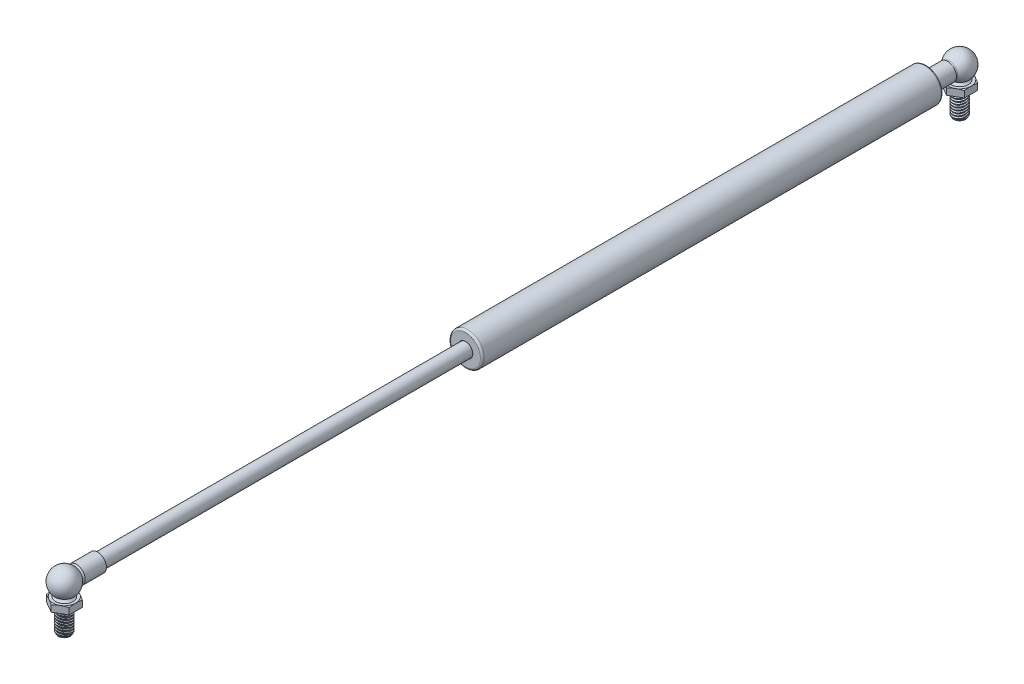
from build123d import *
from build123d.topology import SkipClean

# Parameters (mm, degrees)
FILLET2_R           = 1.0876
EXTRUDE1_DEPTH      = 4
SKETCH6_OUTSIDE_W   = 1534.002
SKETCH6_OUTSIDE_H   = 1804.448
SKETCH6_OUTSIDE_R   = 6.5
CUT_EXTRUDE2_DEPTH  = 264.747499835
CUT_EXTRUDE2_DRAFT  = -70
LPATTERN1_COUNT     = 10
LPATTERN1_PITCH     = 1.411111111
LPATTERN1_COL_COUNT = 2
LPATTERN1_COL_PITCH = 1.411111111
SKETCH9_W           = 230.058
SKETCH9_H           = 3.937
SPLIT1_START        = 6.466
SPLIT1_OUTLINE_R    = 3.937
SPLIT1_DEPTH        = 20
SPLIT1_2_OUTLINE_R  = 3.937
SPLIT1_2_DEPTH      = 20


# Read off the part's stored shape, not the designer's step: Split1
with BuildPart() as part:
    # Sketch1 → Revolve1 (revolve)
    with BuildSketch(Plane(origin=(0, 0, 0), x_dir=(0, 0, -1), z_dir=(1, 0, 0)), mode=Mode.PRIVATE) as revolve1_sk:
        Polygon((236.524, 0), (236.524, 9.525), (-26.466, 9.525), (-26.466, 4.087), (183.592, 4.087), (203.592, 4.087), (203.592, 0), align=None)
    revolve(revolve1_sk.sketch.rotate(Axis((0, 0, 255.524), (0, 0, -1)), 90), axis=Axis((0, 0, 255.524), (0, 0, -1)))

    # Fillet2
    fillet2_edges = [part.edges().sort_by_distance(p)[0] for p in [
        (-9.525, 0, 26.466),
        (-9.525, 0, -236.524),
    ]]
    fillet(fillet2_edges, radius=FILLET2_R)


with BuildPart() as body_2:
    # Sketch2 → Revolve2 (revolve)
    with BuildSketch(Plane(origin=(0, 0, 0), x_dir=(0, 0, -1), z_dir=(1, 0, 0))):
        with BuildLine():
            Line((236.524, 5.05), (248.639302007, 5.05))
            ThreePointArc((248.639302007, 5.05), (249.062650369, 4.451310945), (249.768210934, 4.650902302))
            ThreePointArc((249.768210934, 4.650902302), (257.990491528, 6.976848826), (262.924, 0))
            Line((262.924, 0), (260.624, 0))
            ThreePointArc((260.624, 0), (255.524, 5.1), (250.424, 0))
            Line((250.424, 0), (236.524, 0))
            Line((236.524, 0), (236.524, 5.05))
        make_face()
    revolve(axis=Axis((0, 0, -236.524), (0, 0, 1)))

    # Sketch3 → Cut-Revolve1 (revolve, cut)
    with SkipClean():  # the faces are left unmerged after this step: merging them gives an invalid solid
        with BuildSketch(Plane(origin=(0, 0, 0), x_dir=(0, 0, -1), z_dir=(1, 0, 0))):
            Polygon((260.624, -5.05), (260.933020244, -5.05), (260.933020244, -7.4), (255.524, -7.4), (255.524, 0), (260.624, 0), align=None)
        revolve(axis=Axis((0, 0, -255.524), (0, 1, 0)), mode=Mode.SUBTRACT)


with BuildPart() as body_3:
    # Sketch4 → Revolve3 (revolve)
    with BuildSketch(Plane(origin=(0, 0, 0), x_dir=(0, 0, -1), z_dir=(1, 0, 0))):
        with BuildLine():
            Line((255.524, 4.534838019), (255.524, -11.43))
            Line((255.524, -11.43), (262.024, -11.43))
            Line((262.024, -11.43), (262.024, -7.43))
            Line((262.024, -7.43), (260.524, -7.43))
            ThreePointArc((260.524, -7.43), (258.932864934, -5.442179445), (259.49275, -2.958297388))
            ThreePointArc((259.49275, -2.958297388), (260.309048994, 1.267204058), (257.508375, 4.534838019))
            Line((257.508375, 4.534838019), (255.524, 4.534838019))
        make_face()
    revolve(axis=Axis((0, -25.4, -255.524), (0, -1, 0)))

    # Sketch5 → Extrude1 (add)
    with BuildSketch(Plane.XZ.offset(11.43)):
        Polygon((0, -263.029553499), (6.5, -259.27677675), (6.5, -251.77122325), (0, -248.018446501), (-6.5, -251.77122325), (-6.5, -259.27677675), align=None)
    extrude(amount=-EXTRUDE1_DEPTH)


with BuildPart() as cut_extrude2_tool:
    # Sketch6 outside → Cut-Extrude2 (with draft: the straight prism first)
    with BuildSketch(Plane(origin=(0, -7.43, 0), x_dir=(-1, 0, 0), z_dir=(0, 1, 0))):
        with Locations((0, -118.282)):
            Rectangle(SKETCH6_OUTSIDE_W, SKETCH6_OUTSIDE_H)
        with Locations((0, -255.524)):
            Circle(SKETCH6_OUTSIDE_R, mode=Mode.SUBTRACT)
    extrude(amount=-CUT_EXTRUDE2_DEPTH)
    # Cut-Extrude2: the draft: its side faces are tilted about the plane it starts from
    cut_extrude2_sides = [cut_extrude2_tool.faces().sort_by_distance(p)[0] for p in [
        (0, -139.803749918, -1020.506),
        (-767.001, -139.803749918, -118.282),
        (0, -139.803749918, 783.942),
        (767.001, -139.803749918, -118.282),
        (6.5, -139.803749918, -255.524),
    ]]
    draft(cut_extrude2_sides, Plane(origin=(0, -7.43, 0), x_dir=(-1, 0, 0), z_dir=(0, 1, 0)), CUT_EXTRUDE2_DRAFT)


with BuildPart() as body_3_1:
    add(body_3.part)

    # Cut-Extrude2: cut by cut_extrude2_tool
    add(cut_extrude2_tool.part, mode=Mode.SUBTRACT)


with BuildPart() as body_4:
    # Sketch7 → Revolve4 (revolve)
    with BuildSketch(Plane(origin=(0, 0, 0), x_dir=(0, 0, -1), z_dir=(1, 0, 0)), mode=Mode.PRIVATE) as revolve4_sk:
        Polygon((255.524, -11.43), (259.49275, -11.43), (259.49275, -24.253635855), (258.95819162, -25.4), (255.524, -25.4), align=None)
    revolve(revolve4_sk.sketch.rotate(Axis((0, -25.4, -255.524), (0, -1, 0)), 180), axis=Axis((0, -25.4, -255.524), (0, -1, 0)))

    # Sketch8 → Cut-Revolve2 (revolve, cut)
    with BuildSketch(Plane(origin=(0, 0, 0), x_dir=(0, 0, -1), z_dir=(1, 0, 0)), mode=Mode.PRIVATE) as cut_revolve2_sk:
        Polygon((259.523623935, -11.603665887), (259.739741483, -12.819327094), (258.910561296, -12.518850439), (258.848813425, -12.171518666), align=None)
    cut_revolve2 = revolve(cut_revolve2_sk.sketch.rotate(Axis((0, -11.43, -255.255244232), (0, -0.9845625077859066, -0.175033334717495)), 180), axis=Axis((0, -11.43, -255.255244232), (0, -0.9845625077859066, -0.175033334717495)), mode=Mode.SUBTRACT)

    # LPattern1: Cut-Revolve2 ×10
    with Locations(*[(0, -i * LPATTERN1_PITCH, 0) for i in range(1, LPATTERN1_COUNT)]):
        add(cut_revolve2, mode=Mode.SUBTRACT)

    # LPattern1 col: Cut-Revolve2 ×2
    with Locations(*[(0, i * LPATTERN1_COL_PITCH, 0) for i in range(1, LPATTERN1_COL_COUNT)]):
        add(cut_revolve2, mode=Mode.SUBTRACT)

    # Combine1: union body 3
    add(body_3_1.part)


with BuildPart() as body_4_2:
    # Sketch9 → Revolve5 (revolve)
    with BuildSketch(Plane(origin=(0, 0, 0), x_dir=(0, 0, -1), z_dir=(1, 0, 0)), mode=Mode.PRIVATE) as revolve5_sk:
        with Locations((-121.495, 1.9685)):
            Rectangle(SKETCH9_W, SKETCH9_H)
    revolve(revolve5_sk.sketch.rotate(Axis((0, 0, 236.524), (0, 0, 1)), 90), axis=Axis((0, 0, 236.524), (0, 0, 1)))


with BuildPart() as body_5:
    # Mirror2: mirrored copy
    add(body_4.part.mirror(Plane.XY))


with BuildPart() as body_6:
    # Mirror2 2: mirrored copy
    add(body_2.part.mirror(Plane.XY))

    # Combine2: union body 4 2
    add(body_4_2.part)

    # Split1 2 outline → Split1 2 (cut)
    with BuildSketch(Plane.XY.offset(SPLIT1_START)):
        Circle(SPLIT1_2_OUTLINE_R)
    extrude(amount=SPLIT1_2_DEPTH, mode=Mode.SUBTRACT)


with BuildPart() as body_2_1:
    add(body_2.part)

    # Combine3: union part
    add(part.part)


with BuildPart() as body_5_2:
    # Split1 outline → Split1 (new body)
    with BuildSketch(Plane.XY.offset(SPLIT1_START)):
        Circle(SPLIT1_OUTLINE_R)
    extrude(amount=SPLIT1_DEPTH)


solid = Compound([body_4.part, body_5.part, body_6.part, body_2_1.part, body_5_2.part])
